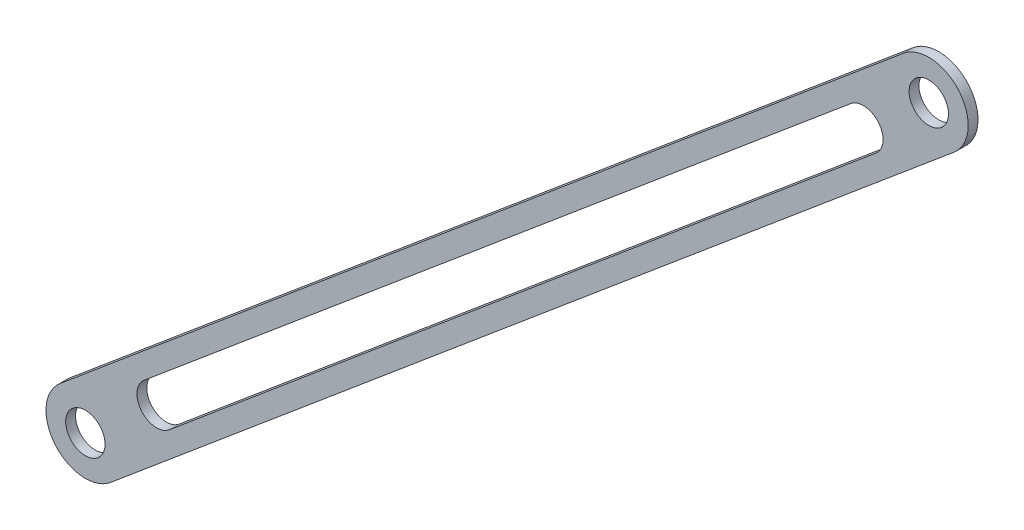
from build123d import *

# Parameters (mm, degrees)
SKETCH1_R           = 12.7
BOSS_EXTRUDE1_DEPTH = 6.35


with BuildPart() as part:
    # Sketch1 → Boss-Extrude1 (new body)
    with BuildSketch(Plane.XY):
        with BuildLine():
            Line((568.345160721, 503.256723569), (24.397466662, 46.830414104))
            ThreePointArc((24.397466662, 46.830414104), (21.266743093, 11.046079963), (57.051077234, 7.915356394))
            Line((57.051077234, 7.915356394), (600.998771294, 464.341665859))
            ThreePointArc((600.998771294, 464.341665859), (604.129494863, 500.126), (568.345160721, 503.256723569))
        make_face()
        with Locations((40.724271948, 27.372885249)):
            Circle(SKETCH1_R, mode=Mode.SUBTRACT)
        with Locations((584.671966007, 483.799194714)):
            Circle(SKETCH1_R, mode=Mode.SUBTRACT)
        with BuildLine():
            Line((550.655030801, 438.676924354), (94.83943152, 56.202223113))
            ThreePointArc((94.83943152, 56.202223113), (76.94726445, 57.767584897), (78.512626234, 75.659751968))
            Line((78.512626234, 75.659751968), (534.328225515, 458.134453209))
            ThreePointArc((534.328225515, 458.134453209), (552.220392586, 456.569091425), (550.655030801, 438.676924354))
        make_face(mode=Mode.SUBTRACT)
    extrude(amount=BOSS_EXTRUDE1_DEPTH)


solid = part.part
